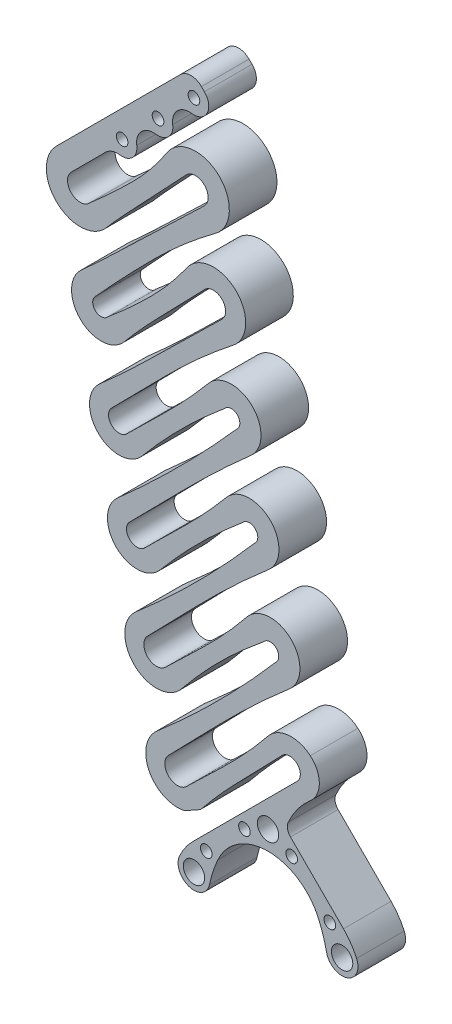
from build123d import *

# Parameters (mm, degrees)
DODANIE_WYCI_GNI_CIE1_DEPTH     = 22.5
WYTNIJ_WYCI_GNI_CIE1_DEPTH      = 22.5
WYTNIJ_WYCI_GNI_CIE2_DEPTH      = 344.165047754
WYTNIJ_WYCI_GNI_CIE2_DEPTH_BACK = 344.165047754
DODANIE_WYCI_GNI_CIE5_DEPTH     = 22.5
WYTNIJ_WYCI_GNI_CIE6_DEPTH      = 344.165047754
WYTNIJ_WYCI_GNI_CIE6_DEPTH_BACK = 344.165047754
DODANIE_WYCI_GNI_CIE8_DEPTH     = 22.5
OTW_R_POD_RUB_M51_D             = 5.5
ZAOKR_GLENIE6_R                 = 7
BODY_MOVE_COPY1_ANGLE           = 33.6329965
BODY_MOVE_COPY2_ANGLE           = 67.2629965
BODY_MOVE_COPY3_ANGLE           = 11.37
CUT_EXTRUDE1_DEPTH              = 394.621212419
SKETCH5_R                       = 5.05
SKETCH5_R_2                     = 2.75
BOSS_EXTRUDE1_DEPTH             = 22.5
CUT_EXTRUDE2_DEPTH              = 391.35937763
FILLET1_R                       = 5
CUT_EXTRUDE3_DEPTH              = 390.415520823


with BuildPart() as part:
    # Szkic1 → Dodanie-wyciągnięcie1 (new body)
    with BuildSketch(Plane.XY):
        with BuildLine():
            Line((0, 0), (0, -8))
            ThreePointArc((0, -8), (-0.585786438, -9.414213562), (-2, -10))
            Line((-2, -10), (-90, -10))
            ThreePointArc((-90, -10), (-96, -16), (-90, -22))
            Line((-90, -22), (-33, -22))
            ThreePointArc((-33, -22), (-19, -36), (-33, -50))
            Line((-33, -50), (-114, -50))
            ThreePointArc((-114, -50), (-118, -54), (-114, -58))
            Line((-114, -58), (-57, -58))
            ThreePointArc((-57, -58), (-43, -72), (-57, -86))
            Line((-57, -86), (-138, -86))
            ThreePointArc((-138, -86), (-142, -90), (-138, -94))
            Line((-138, -94), (-81, -94))
            ThreePointArc((-81, -94), (-67, -108), (-81, -122))
            Line((-81, -122), (-162, -122))
            ThreePointArc((-162, -122), (-166, -126), (-162, -130))
            Line((-162, -130), (-105, -130))
            ThreePointArc((-105, -130), (-91, -144), (-105, -158))
            Line((-105, -158), (-186, -158))
            ThreePointArc((-186, -158), (-191, -163), (-186, -168))
            Line((-186, -168), (-129, -168))
            ThreePointArc((-129, -168), (-115, -182), (-129, -196))
            Line((-129, -196), (-210, -196))
            ThreePointArc((-210, -196), (-215, -201), (-210, -206))
            Line((-210, -206), (-153, -206))
            ThreePointArc((-153, -206), (-139, -220), (-153, -234))
            Line((-153, -234), (-250, -234))
            Line((-250, -234), (-250, -224))
            Line((-250, -224), (-153, -224))
            ThreePointArc((-153, -224), (-149, -220), (-153, -216))
            Line((-153, -216), (-210, -216))
            ThreePointArc((-210, -216), (-225, -201), (-210, -186))
            Line((-210, -186), (-129, -186))
            ThreePointArc((-129, -186), (-125, -182), (-129, -178))
            Line((-129, -178), (-186, -178))
            ThreePointArc((-186, -178), (-201, -163), (-186, -148))
            Line((-186, -148), (-105, -148))
            ThreePointArc((-105, -148), (-101, -144), (-105, -140))
            Line((-105, -140), (-162, -140))
            ThreePointArc((-162, -140), (-176, -126), (-162, -112))
            Line((-162, -112), (-81, -112))
            ThreePointArc((-81, -112), (-77, -108), (-81, -104))
            Line((-81, -104), (-138, -104))
            ThreePointArc((-138, -104), (-152, -90), (-138, -76))
            Line((-138, -76), (-57, -76))
            ThreePointArc((-57, -76), (-53, -72), (-57, -68))
            Line((-57, -68), (-114, -68))
            ThreePointArc((-114, -68), (-128, -54), (-114, -40))
            Line((-114, -40), (-33, -40))
            ThreePointArc((-33, -40), (-29, -36), (-33, -32))
            Line((-33, -32), (-90, -32))
            ThreePointArc((-90, -32), (-106, -16), (-90, 0))
            Line((-90, 0), (0, 0))
        make_face()
    extrude(amount=DODANIE_WYCI_GNI_CIE1_DEPTH)

    # Szkic8 → Wytnij-wyciągnięcie1 (cut)
    with BuildSketch(Plane(origin=(0, 0, 0), x_dir=(-1, 0, 0), z_dir=(0, 0, -1))):
        with BuildLine():
            ThreePointArc((153, -206), (154.051176662, -206.027643413), (155.099447514, -206.110497238))
            ThreePointArc((155.099447514, -206.110497238), (181.5, -207.5), (207.900552486, -206.110497238))
            ThreePointArc((207.900552486, -206.110497238), (208.948823338, -206.027643413), (210, -206))
            Line((210, -206), (153, -206))
        make_face()
        with BuildLine():
            Line((129, -186), (210, -186))
            ThreePointArc((210, -186), (209.25976679, -186.013703325), (208.520547945, -186.054794521))
            ThreePointArc((208.520547945, -186.054794521), (169.5, -187.5), (130.479452055, -186.054794521))
            ThreePointArc((130.479452055, -186.054794521), (129.74023321, -186.013703325), (129, -186))
        make_face()
        with BuildLine():
            ThreePointArc((130.479452055, -195.945205479), (169.5, -194.5), (208.520547945, -195.945205479))
            ThreePointArc((208.520547945, -195.945205479), (209.25976679, -195.986296675), (210, -196))
            Line((210, -196), (129, -196))
            ThreePointArc((129, -196), (129.74023321, -195.986296675), (130.479452055, -195.945205479))
        make_face()
        with BuildLine():
            ThreePointArc((131.099447514, -168.110497238), (157.499999865, -169.499999993), (183.900552216, -168.110497238))
            ThreePointArc((183.900552216, -168.110497238), (184.948823202, -168.027643406), (186, -168))
            Line((186, -168), (129, -168))
            ThreePointArc((129, -168), (130.051176662, -168.027643413), (131.099447514, -168.110497238))
        make_face()
        with BuildLine():
            ThreePointArc((183.900552476, -177.889502761), (157.5, -176.499999993), (131.099447524, -177.889502761))
            ThreePointArc((131.099447524, -177.889502761), (130.051176667, -177.972356586), (129, -178))
            Line((129, -178), (186, -178))
            ThreePointArc((186, -178), (184.948823333, -177.972356586), (183.900552476, -177.889502761))
        make_face()
        with BuildLine():
            ThreePointArc((106.479452055, -157.945205479), (145.5, -156.5), (184.520547945, -157.945205479))
            ThreePointArc((184.520547945, -157.945205479), (185.25976679, -157.986296675), (186, -158))
            Line((186, -158), (105, -158))
            ThreePointArc((105, -158), (105.74023321, -157.986296675), (106.479452055, -157.945205479))
        make_face()
        with BuildLine():
            ThreePointArc((184.520547945, -148.054794521), (145.5, -149.5), (106.479452055, -148.054794521))
            ThreePointArc((106.479452055, -148.054794521), (105.74023321, -148.013703325), (105, -148))
            Line((105, -148), (186, -148))
            ThreePointArc((186, -148), (185.25976679, -148.013703325), (184.520547945, -148.054794521))
        make_face()
        with BuildLine():
            Line((162, -140), (105, -140))
            ThreePointArc((105, -140), (105.876350483, -139.980791021), (106.751017587, -139.923200983))
            ThreePointArc((106.751017587, -139.923200983), (133.5, -138.75), (160.248982413, -139.923200983))
            ThreePointArc((160.248982413, -139.923200983), (161.123649517, -139.980791021), (162, -140))
        make_face()
        with BuildLine():
            ThreePointArc((106.751017587, -130.076799017), (133.5, -131.25), (160.248982413, -130.076799017))
            ThreePointArc((160.248982413, -130.076799017), (161.123649517, -130.019208979), (162, -130))
            Line((162, -130), (105, -130))
            ThreePointArc((105, -130), (105.876350483, -130.019208979), (106.751017587, -130.076799017))
        make_face()
        with BuildLine():
            Line((210, -216), (153, -216))
            ThreePointArc((153, -216), (154.051176662, -215.972356587), (155.099447514, -215.889502762))
            ThreePointArc((155.099447514, -215.889502762), (181.5, -214.5), (207.900552486, -215.889502762))
            ThreePointArc((207.900552486, -215.889502762), (208.948823338, -215.972356587), (210, -216))
        make_face()
        with BuildLine():
            Line((81, -112), (162, -112))
            ThreePointArc((162, -112), (161.383009851, -112.009519186), (160.766607027, -112.038067684))
            ThreePointArc((160.766607027, -112.038067684), (121.5, -113.25), (82.233392973, -112.038067684))
            ThreePointArc((82.233392973, -112.038067684), (81.616990149, -112.009519186), (81, -112))
        make_face()
        with BuildLine():
            ThreePointArc((82.233392973, -121.961932316), (121.5, -120.75), (160.766607027, -121.961932316))
            ThreePointArc((160.766607027, -121.961932316), (161.383009851, -121.990480814), (162, -122))
            Line((162, -122), (81, -122))
            ThreePointArc((81, -122), (81.616990149, -121.990480814), (82.233392973, -121.961932316))
        make_face()
        with BuildLine():
            Line((81, -94), (138, -94))
            ThreePointArc((138, -94), (137.123649517, -94.019208979), (136.248982413, -94.076799017))
            ThreePointArc((136.248982413, -94.076799017), (109.5, -95.25), (82.751017587, -94.076799017))
            ThreePointArc((82.751017587, -94.076799017), (81.876350483, -94.019208979), (81, -94))
        make_face()
        with BuildLine():
            Line((81, -104), (138, -104))
            ThreePointArc((138, -104), (137.123649517, -103.980791021), (136.248982413, -103.923200983))
            ThreePointArc((136.248982413, -103.923200983), (109.5, -102.75), (82.751017587, -103.923200983))
            ThreePointArc((82.751017587, -103.923200983), (81.876350483, -103.980791021), (81, -104))
        make_face()
        with BuildLine():
            ThreePointArc((58.233392973, -85.961932316), (97.5, -84.75), (136.766607027, -85.961932316))
            ThreePointArc((136.766607027, -85.961932316), (137.383009851, -85.990480814), (138, -86))
            Line((138, -86), (57, -86))
            ThreePointArc((57, -86), (57.616990149, -85.990480814), (58.233392973, -85.961932316))
        make_face()
        with BuildLine():
            Line((57, -76), (138, -76))
            ThreePointArc((138, -76), (137.383009851, -76.009519186), (136.766607027, -76.038067684))
            ThreePointArc((136.766607027, -76.038067684), (97.5, -77.25), (58.233392973, -76.038067684))
            ThreePointArc((58.233392973, -76.038067684), (57.616990149, -76.009519186), (57, -76))
        make_face()
        with BuildLine():
            ThreePointArc((58.751017587, -67.923200983), (85.5, -66.75), (112.248982413, -67.923200983))
            ThreePointArc((112.248982413, -67.923200983), (113.123649517, -67.980791021), (114, -68))
            Line((114, -68), (57, -68))
            ThreePointArc((57, -68), (57.876350483, -67.980791021), (58.751017587, -67.923200983))
        make_face()
        with BuildLine():
            ThreePointArc((112.248982413, -58.076799017), (85.5, -59.25), (58.751017587, -58.076799017))
            ThreePointArc((58.751017587, -58.076799017), (57.876350483, -58.019208979), (57, -58))
            Line((57, -58), (114, -58))
            ThreePointArc((114, -58), (113.123649517, -58.019208979), (112.248982413, -58.076799017))
        make_face()
        with BuildLine():
            ThreePointArc((113.012947449, -49.975628332), (73.5, -49), (33.987052551, -49.975628332))
            ThreePointArc((33.987052551, -49.975628332), (33.493676695, -49.993906155), (33, -50))
            Line((33, -50), (114, -50))
            ThreePointArc((114, -50), (113.506323305, -49.993906155), (113.012947449, -49.975628332))
        make_face()
        with BuildLine():
            ThreePointArc((33.987052551, -40.024371668), (73.5, -41), (113.012947449, -40.024371668))
            ThreePointArc((113.012947449, -40.024371668), (113.506323305, -40.006093845), (114, -40))
            Line((114, -40), (33, -40))
            ThreePointArc((33, -40), (33.493676695, -40.006093845), (33.987052551, -40.024371668))
        make_face()
        with BuildLine():
            Line((90, -32), (33, -32))
            ThreePointArc((33, -32), (33.701322803, -31.987699876), (34.40178297, -31.950814633))
            ThreePointArc((34.40178297, -31.950814633), (61.5, -31), (88.59821703, -31.950814633))
            ThreePointArc((88.59821703, -31.950814633), (89.298677197, -31.987699876), (90, -32))
        make_face()
        with BuildLine():
            Line((33, -22), (90, -22))
            ThreePointArc((90, -22), (89.298677197, -22.012300124), (88.59821703, -22.049185367))
            ThreePointArc((88.59821703, -22.049185367), (61.5, -23), (34.40178297, -22.049185367))
            ThreePointArc((34.40178297, -22.049185367), (33.701322803, -22.012300124), (33, -22))
        make_face()
    extrude(amount=-WYTNIJ_WYCI_GNI_CIE1_DEPTH, mode=Mode.SUBTRACT)

    # Szkic9 → Wytnij-wyciągnięcie2 (cut, two sides: drawn at the far end of the back side and taken through both)
    with BuildSketch(Plane.XY.offset(22.5).offset(-WYTNIJ_WYCI_GNI_CIE2_DEPTH_BACK)):
        with BuildLine():
            ThreePointArc((-210.114686482, -206.998903817), (-215.999976535, -200.983219822), (-210.081130595, -195.00054854))
            Line((-210.081130595, -195.00054854), (-176.632731469, -194.548225767))
            Line((-176.632731469, -194.548225767), (-186.307275022, -207.454051681))
            Line((-186.307275022, -207.454051681), (-210.114686482, -206.998903817))
        make_face()
        with BuildLine():
            Line((-153, -224), (-185.619818696, -214.533745616))
            Line((-185.619818696, -214.533745616), (-153.081904944, -214.000670887))
            ThreePointArc((-153.081904944, -214.000670887), (-148.000167725, -218.959046154), (-153, -224))
        make_face()
        with BuildLine():
            Line((-125.640287936, -120.7634612), (-162.032512371, -121.000105707))
            ThreePointArc((-162.032512371, -121.000105707), (-166.999995385, -125.993206635), (-162.046098683, -130.999787487))
            Line((-162.046098683, -130.999787487), (-136.316859996, -131.237014371))
            Line((-136.316859996, -131.237014371), (-125.640287936, -120.7634612))
        make_face()
        with BuildLine():
            Line((-101.640287936, -84.7634612), (-138.032512371, -85.000105707))
            ThreePointArc((-138.032512371, -85.000105707), (-142.999995385, -89.993206635), (-138.046098683, -94.999787487))
            Line((-138.046098683, -94.999787487), (-112.316859996, -95.237014371))
            Line((-112.316859996, -95.237014371), (-101.640287936, -84.7634612))
        make_face()
        with BuildLine():
            Line((-162.307274757, -169.454051676), (-186.114686479, -168.998903817))
            ThreePointArc((-186.114686479, -168.998903817), (-191.999976535, -162.983219824), (-186.081130595, -157.00054854))
            Line((-186.081130595, -157.00054854), (-152.632731469, -156.548225767))
            Line((-152.632731469, -156.548225767), (-162.307274757, -169.454051676))
        make_face()
    extrude(amount=WYTNIJ_WYCI_GNI_CIE2_DEPTH + WYTNIJ_WYCI_GNI_CIE2_DEPTH_BACK, mode=Mode.SUBTRACT)

    # Szkic10 → Dodanie-wyciągnięcie5 (add)
    with BuildSketch(Plane.XY.offset(22.5)):
        with BuildLine():
            ThreePointArc((-58.788214182, -87.144794156), (-80.177318778, -85.289531493), (-101.640287936, -84.7634612))
            Line((-101.640287936, -84.7634612), (-53.175843018, -77.439330373))
            Line((-53.175843018, -77.439330373), (-50.404284984, -64.475807604))
            Line((-50.404284984, -64.475807604), (-85.5, -59.25))
            ThreePointArc((-85.5, -59.25), (-72.527882652, -58.68213777), (-59.655009163, -56.982895541))
            ThreePointArc((-59.655009163, -56.982895541), (-41.756293415, -71.561925178), (-58.788214182, -87.144794156))
        make_face()
        with BuildLine():
            ThreePointArc((-36.331506849, -20.350684932), (-17.007656619, -35.505072545), (-35.357435198, -51.825375171))
            ThreePointArc((-35.357435198, -51.825375171), (-54.376467412, -49.707310065), (-73.5, -49))
            Line((-73.5, -49), (-26.341857482, -38.077852405))
            Line((-26.341857482, -38.077852405), (-28.727188308, -24.939302086))
            Line((-28.727188308, -24.939302086), (-61.5, -23))
            ThreePointArc((-61.5, -23), (-48.846226671, -22.335846622), (-36.331506849, -20.350684932))
        make_face()
    extrude(amount=-DODANIE_WYCI_GNI_CIE5_DEPTH)

    # Szkic11 → Wytnij-wyciągnięcie6 (cut, two sides: drawn at the far end of the back side and taken through both)
    with BuildSketch(Plane.XY.offset(22.5).offset(-WYTNIJ_WYCI_GNI_CIE6_DEPTH_BACK)):
        with BuildLine():
            ThreePointArc((-57.092959597, -66.250751483), (-51.250016731, -71.986129004), (-57.06522023, -77.749630103))
            Line((-57.06522023, -77.749630103), (-104.722147972, -77.209039539))
            Line((-104.722147972, -77.209039539), (-90.439387992, -66.789929872))
            Line((-90.439387992, -66.789929872), (-57.092959597, -66.250751483))
        make_face()
        with BuildLine():
            Line((-72.838868216, -31.166307909), (-33.175966917, -30.002580918))
            ThreePointArc((-33.175966917, -30.002580918), (-27.000057891, -35.973643045), (-33.123269399, -41.998733588))
            Line((-33.123269399, -41.998733588), (-89.948760412, -40.831013099))
            Line((-89.948760412, -40.831013099), (-72.838868216, -31.166307909))
        make_face()
    extrude(amount=WYTNIJ_WYCI_GNI_CIE6_DEPTH + WYTNIJ_WYCI_GNI_CIE6_DEPTH_BACK, mode=Mode.SUBTRACT)

    # Szkic13 → Dodanie-wyciągnięcie8 (add)
    with BuildSketch(Plane.XY.offset(22.5)):
        with BuildLine():
            Line((0, 0), (-67, 0))
            Line((-67, 0), (-67, -10))
            ThreePointArc((-67, -10), (-63.422291236, -10.844582472), (-60.6, -13.2))
            ThreePointArc((-60.6, -13.2), (-55, -16), (-49.4, -13.2))
            ThreePointArc((-49.4, -13.2), (-43, -10), (-36.6, -13.2))
            ThreePointArc((-36.6, -13.2), (-31, -16), (-25.4, -13.2))
            ThreePointArc((-25.4, -13.2), (-19, -10), (-12.6, -13.2))
            ThreePointArc((-12.6, -13.2), (-4.786405638, -15.640783086), (0, -9))
            Line((0, -9), (0, 0))
        make_face()
    extrude(amount=-DODANIE_WYCI_GNI_CIE8_DEPTH)

    # Otwór pod śrubę M51 (through all)
    with Locations(Plane.XY.offset(22.5)):
        with Locations((-31, -9), (-55, -9), (-7, -9)):
            Hole(OTW_R_POD_RUB_M51_D / 2)

    # Zaokrąglenie6
    zaokr_glenie6_edges = [part.edges().sort_by_distance(p)[0] for p in [
        (0, 0, 11.25),
    ]]
    fillet(zaokr_glenie6_edges, radius=ZAOKR_GLENIE6_R)


with BuildPart() as part_1:
    # Body-Move/Copy1: read off the stored shape, not the designer's step
    # Body-Move/Copy1: moved
    add(part.part.moved(Location((167.9277216, -100.9707225, 0))).rotate(Axis((0, 0, 0), (0, 0, -1)), BODY_MOVE_COPY1_ANGLE))


with BuildPart() as part_2:
    # Body-Move/Copy2: read off the stored shape, not the designer's step
    # Body-Move/Copy2: moved
    add(part_1.part.moved(Location((-55.2727925, 367.1347789, -22.5))).rotate(Axis((0, 0, 0), (0, 0, 1)), BODY_MOVE_COPY2_ANGLE))


with BuildPart() as part_3:
    # Body-Move/Copy3: read off the stored shape, not the designer's step
    # Body-Move/Copy3: moved
    add(part_2.part.moved(Location((-47.1047015, 35.4816006, 0))).rotate(Axis((0, 0, 0), (0, 0, 1)), BODY_MOVE_COPY3_ANGLE))

    # Sketch8 → Cut-Extrude1 (cut, through all)
    with BuildSketch(Plane.XY):
        Polygon((-203.812310457, -195.717987627), (-181.237688308, -198.442258643), (-242.892605404, -267.411993872), (-270.300403198, -232.927126257), align=None)
    extrude(amount=-CUT_EXTRUDE1_DEPTH, mode=Mode.SUBTRACT)

    # Sketch5 → Boss-Extrude1 (add)
    with BuildSketch(Plane.XY):
        with BuildLine():
            Line((-191.084388396, -195.717987627), (-156.084388396, -230.717987627))
            ThreePointArc((-156.084388396, -230.717987627), (-159.004198536, -245.396864451), (-171.448349427, -237.081948658))
            ThreePointArc((-171.448349427, -237.081948658), (-177.881321072, -219.960868045), (-193.996918762, -211.312050979))
            ThreePointArc((-193.996918762, -211.312050979), (-214.56943004, -217.514920303), (-223.448349427, -237.081948658))
            ThreePointArc((-223.448349427, -237.081948658), (-235.892500318, -245.396864451), (-238.812310457, -230.717987627))
            Line((-238.812310457, -230.717987627), (-203.812310457, -195.717987627))
            ThreePointArc((-203.812310457, -195.717987627), (-197.448349427, -193.081948658), (-191.084388396, -195.717987627))
        make_face()
        with Locations((-197.448349427, -202.081948658)):
            Circle(SKETCH5_R, mode=Mode.SUBTRACT)
        with Locations((-232.448349427, -237.081948658)):
            Circle(SKETCH5_R, mode=Mode.SUBTRACT)
        with Locations((-162.448349427, -237.081948658)):
            Circle(SKETCH5_R, mode=Mode.SUBTRACT)
        with Locations((-226.636426597, -225.613171578)):
            Circle(SKETCH5_R_2, mode=Mode.SUBTRACT)
        with Locations((-208.605203676, -207.581948658)):
            Circle(SKETCH5_R_2, mode=Mode.SUBTRACT)
        with Locations((-186.291495177, -207.581948658)):
            Circle(SKETCH5_R_2, mode=Mode.SUBTRACT)
        with Locations((-168.260272257, -225.613171578)):
            Circle(SKETCH5_R_2, mode=Mode.SUBTRACT)
    extrude(amount=-BOSS_EXTRUDE1_DEPTH)

    # Sketch9 → Cut-Extrude2 (cut, through all)
    with BuildSketch(Plane.XY):
        with BuildLine():
            ThreePointArc((-239.302040172, -234.036144466), (-234.750690359, -244.219821326), (-225.10668276, -238.614896979))
            ThreePointArc((-225.10668276, -238.614896979), (-223.479622905, -232.4699657), (-221.211584721, -226.531657271))
            ThreePointArc((-221.211584721, -226.531657271), (-232.490808502, -267.345188376), (-233.100480628, -225.006157798))
            ThreePointArc((-233.100480628, -225.006157798), (-236.616914153, -229.235690965), (-239.302040172, -234.036144466))
        make_face()
        with BuildLine():
            ThreePointArc((-169.790016093, -238.614896979), (-160.146008494, -244.219821326), (-155.594658682, -234.036144466))
            ThreePointArc((-155.594658682, -234.036144466), (-158.2797847, -229.235690965), (-161.796218226, -225.006157798))
            ThreePointArc((-161.796218226, -225.006157798), (-163.181965134, -261.296892411), (-173.685114133, -226.531657271))
            ThreePointArc((-173.685114133, -226.531657271), (-171.417075948, -232.4699657), (-169.790016093, -238.614896979))
        make_face()
    extrude(amount=-CUT_EXTRUDE2_DEPTH, mode=Mode.SUBTRACT)

    # Fillet1
    fillet1_edges = [part_3.edges().sort_by_distance(p)[0] for p in [
        (-190.377281513, -196.42509451, -11.25),
    ]]
    fillet(fillet1_edges, radius=FILLET1_R)

    # Sketch10 → Cut-Extrude3 (cut, through all)
    with BuildSketch(Plane.XY):
        with BuildLine():
            Line((-187.873423393, -194.390248821), (-141.443522951, -197.530263815))
            Line((-141.443522951, -197.530263815), (-146.258197059, -153.448494611))
            Line((-146.258197059, -153.448494611), (-177.466549206, -162.028124789))
            ThreePointArc((-177.466549206, -162.028124789), (-173.197981009, -171.151156446), (-177.38352408, -180.312576111))
            ThreePointArc((-177.38352408, -180.312576111), (-183.410346971, -186.768803985), (-187.873423393, -194.390248821))
        make_face()
    extrude(amount=-CUT_EXTRUDE3_DEPTH, mode=Mode.SUBTRACT)


solid = part_3.part
